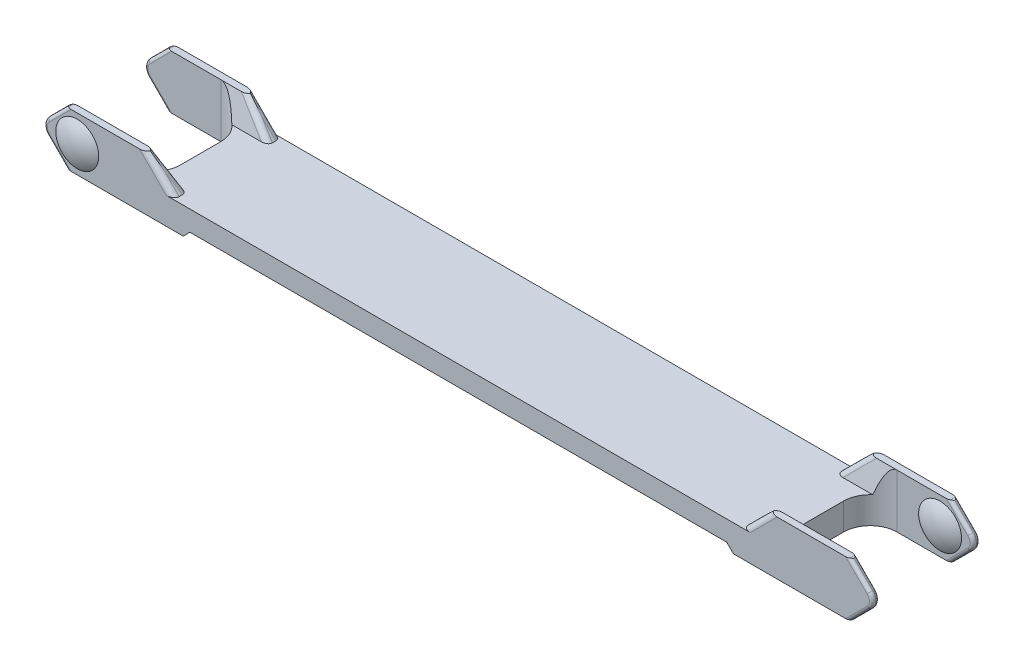
from build123d import *

# Parameters (mm, degrees)
BOSS_EXTRUDE1_DEPTH = 12.7
CUT_EXTRUDE2_DEPTH  = 199.932436772
CUT_EXTRUDE1_DEPTH  = 104.050150898
CUT_EXTRUDE3_DEPTH  = 63.5
CHAMFER1_SIZE       = 1.5875
FILLET1_R           = 0.762
FILLET2_R           = 1.27


# Some blends are built 0.0001 mm under size
with BuildPart() as part:
    # Sketch1 → Boss-Extrude1 (new body)
    with BuildSketch(Plane(origin=(0, 0, 0), x_dir=(1, 0, 0), z_dir=(0, 1, 0))):
        with BuildLine():
            Line((-99.06, -12.7), (99.06, -12.7))
            Line((99.06, -12.7), (99.06, -11.1125))
            Line((99.06, -11.1125), (80.01, -11.1125))
            ThreePointArc((80.01, -11.1125), (75.519871939, -9.252628061), (73.66, -4.7625))
            Line((73.66, -4.7625), (73.66, 4.7625))
            ThreePointArc((73.66, 4.7625), (75.519871939, 9.252628061), (80.01, 11.1125))
            Line((80.01, 11.1125), (99.06, 11.1125))
            Line((99.06, 11.1125), (99.06, 12.7))
            Line((99.06, 12.7), (-99.06, 12.7))
            Line((-99.06, 12.7), (-99.06, 11.1125))
            Line((-99.06, 11.1125), (-80.01, 11.1125))
            ThreePointArc((-80.01, 11.1125), (-75.519871939, 9.252628061), (-73.66, 4.7625))
            Line((-73.66, 4.7625), (-73.66, -4.7625))
            ThreePointArc((-73.66, -4.7625), (-75.519871939, -9.252628061), (-80.01, -11.1125))
            Line((-80.01, -11.1125), (-99.06, -11.1125))
            Line((-99.06, -11.1125), (-99.06, -12.7))
        make_face()
    extrude(amount=BOSS_EXTRUDE1_DEPTH)

    # Sketch3 → Cut-Extrude2 (cut, through all)
    with BuildSketch(Plane.ZY.offset(99.06)):
        Polygon((11.1125, 12.7), (4.7625, 12.7), (-4.7625, 12.7), (-11.1125, 12.7), (-9.525, 6.35), (9.525, 6.35), align=None)
    extrude(amount=-CUT_EXTRUDE2_DEPTH, mode=Mode.SUBTRACT)

    # Sketch2 → Cut-Extrude1 (cut, through all)
    with BuildSketch(Plane.XY.offset(12.7)):
        Polygon((73.66, 12.7), (-73.66, 12.7), (-67.31, 6.35), (67.31, 6.35), align=None)
        with BuildLine():
            Line((97.263948776, 4.553948776), (92.71, 0))
            Line((92.71, 0), (99.06, 0))
            Line((99.06, 0), (99.06, 12.7))
            Line((99.06, 12.7), (92.71, 12.7))
            Line((92.71, 12.7), (97.263948776, 8.146051224))
            ThreePointArc((97.263948776, 8.146051224), (98.007897552, 6.35), (97.263948776, 4.553948776))
        make_face()
        with BuildLine():
            ThreePointArc((-97.263948776, 4.553948776), (-98.007897552, 6.35), (-97.263948776, 8.146051224))
            Line((-97.263948776, 8.146051224), (-92.71, 12.7))
            Line((-92.71, 12.7), (-99.06, 12.7))
            Line((-99.06, 12.7), (-99.06, 0))
            Line((-99.06, 0), (-92.71, 0))
            Line((-92.71, 0), (-97.263948776, 4.553948776))
        make_face()
    extrude(amount=-CUT_EXTRUDE1_DEPTH, mode=Mode.SUBTRACT)

    # Sketch4 → Revolve1 (revolve)
    with BuildSketch(Plane.ZY.offset(90.17)):
        with BuildLine():
            Line((12.7, 6.35), (12.7, 11.43))
            ThreePointArc((12.7, 11.43), (13.881381744, 9.01113492), (14.2875, 6.35))
            Line((14.2875, 6.35), (12.7, 6.35))
        make_face()
    revolve1 = revolve(axis=Axis((-90.17, 6.35, 0), (0, 0, 1)))

    # Mirror1: Revolve1 across plane
    add(revolve1.mirror(Plane.XY))

    # Sketch5 → Revolve2 (revolve)
    with BuildSketch(Plane(origin=(90.17, 0, 0), x_dir=(0, 0, -1), z_dir=(1, 0, 0))):
        with BuildLine():
            Line((11.1125, 6.35), (11.1125, 11.43))
            ThreePointArc((11.1125, 11.43), (9.931118256, 9.01113492), (9.525, 6.35))
            Line((9.525, 6.35), (11.1125, 6.35))
        make_face()
    revolve2 = revolve(axis=Axis((90.17, 6.35, 0), (0, 0, -1)))

    # Mirror2: Revolve2 across plane
    add(revolve2.mirror(Plane.XY))

    # Sketch6 → Cut-Extrude3 (cut, symmetric)
    with BuildSketch(Plane(origin=(0, 0, 0), x_dir=(0, 0, -1), z_dir=(1, 0, 0))):
        Polygon((-12.7, 0), (-11.1125, 0), (-12.7, 1.5875), align=None)
        Polygon((11.1125, 0), (12.7, 1.5875), (12.7, 0), align=None)
    extrude(amount=CUT_EXTRUDE3_DEPTH, both=True, mode=Mode.SUBTRACT)

    # Chamfer1
    chamfer1_edges = [part.edges().sort_by_distance(p)[0] for p in [
        (63.5, 0, 11.90625),
        (63.5, 0, -11.90625),
        (-63.5, 0, -11.90625),
        (-63.5, 0, 11.90625),
    ]]
    chamfer(chamfer1_edges, length=CHAMFER1_SIZE - 0.0001)  # a hair under: the kernel refuses the full size

    # Fillet1
    fillet1_edges = [part.edges().sort_by_distance(p)[0] for p in [
        (-98.007897552, 6.35, 12.7),
        (-92.71, 12.7, -11.90625),
        (-94.986974388, 10.423025612, -11.1125),
        (-94.986974388, 10.423025612, -12.7),
        (-94.986974388, 10.423025612, 11.1125),
        (-92.71, 12.7, 11.90625),
        (-94.986974388, 2.276974388, 12.7),
        (-98.007897552, 6.35, -11.1125),
        (-98.007897552, 6.35, 11.1125),
        (-94.986974388, 2.276974388, -11.1125),
        (-94.986974388, 2.276974388, 11.1125),
        (-98.007897552, 6.35, -12.7),
        (-94.986974388, 2.276974388, -12.7),
        (-94.986974388, 10.423025612, 12.7),
        (98.007897552, 6.35, 12.7),
        (92.71, 12.7, 11.90625),
        (92.71, 12.7, -11.90625),
        (94.986974388, 10.423025612, 12.7),
        (94.986974388, 2.276974388, 11.1125),
        (94.986974388, 2.276974388, -11.1125),
        (94.986974388, 2.276974388, -12.7),
        (98.007897552, 6.35, 11.1125),
        (94.986974388, 10.423025612, 11.1125),
        (94.986974388, 10.423025612, -11.1125),
        (98.007897552, 6.35, -12.7),
        (94.986974388, 10.423025612, -12.7),
        (94.986974388, 2.276974388, 12.7),
        (98.007897552, 6.35, -11.1125),
    ]]
    fillet(fillet1_edges, radius=FILLET1_R)

    # Fillet2
    # the kernel refuses this fillet: 1.27 mm, written as the material it takes off along each edge
    with BuildSketch(Plane(origin=(-75.90506403, 14.94506403, -12.7), x_dir=(-0.7071067811865446, -0.7071067811865505, 0), z_dir=(0.7071067811865506, -0.7071067811865446, 0))) as fillet2_piece_1_section:
        with BuildLine():
            CenterArc((FILLET2_R, -FILLET2_R), FILLET2_R, 90, 90)
            Line((0, -FILLET2_R), (0, 0))
            Line((0, 0), (FILLET2_R, 0))
        make_face()
    fillet2_piece_1 = extrude(amount=15.330256121, mode=Mode.PRIVATE)
    fillet2_piece_1 = split(fillet2_piece_1, bisect_by=Plane(origin=(-71.905795305, 6.35, -12.408746665), z_dir=(0, 1, 0)), keep=Keep.TOP, mode=Mode.PRIVATE)
    add(fillet2_piece_1, mode=Mode.SUBTRACT)
    with BuildSketch(Plane(origin=(-65.450815483, 4.490815483, -9.060203871), x_dir=(0.1230914909792504, -0.12309149097924957, -0.9847319278346824), z_dir=(-0.696310623822809, 0.6963106238228031, -0.17407765595558086))) as fillet2_piece_2_section:
        with BuildLine():
            CenterArc((FILLET2_R * 0.840960781889, FILLET2_R), FILLET2_R, 189.874961398, 80.125038602)
            Line((-FILLET2_R * 0.144223584254, FILLET2_R * 0.828501414858), (0, 0))
            Line((0, 0), (FILLET2_R * 0.840960781889, 0))
        make_face()
    fillet2_piece_2 = extrude(amount=14.459594166, mode=Mode.PRIVATE)
    fillet2_piece_2 = split(fillet2_piece_2, bisect_by=Plane(origin=(-71.646234354, 6.35, -10.770930609), z_dir=(0, 1, 0)), keep=Keep.TOP, mode=Mode.PRIVATE)
    add(fillet2_piece_2, mode=Mode.SUBTRACT)
    with BuildSketch(Plane(origin=(-75.519184517, 14.559184517, 11.577296129), x_dir=(-0.7177405625652845, -0.6755205294731655, -0.1688801323683837), z_dir=(0.69631062382278, -0.6963106238227741, -0.17407765595581334))) as fillet2_piece_3_section:
        with BuildLine():
            CenterArc((FILLET2_R * 0.840960781889, -FILLET2_R), FILLET2_R, 90, 80.125038602)
            Line((-FILLET2_R * 0.144223584254, -FILLET2_R * 0.828501414857), (0, 0))
            Line((0, 0), (FILLET2_R * 0.840960781889, 0))
        make_face()
    fillet2_piece_3 = extrude(amount=14.459594166, mode=Mode.PRIVATE)
    fillet2_piece_3 = split(fillet2_piece_3, bisect_by=Plane(origin=(-71.646234354, 6.35, 10.770930609), z_dir=(0, 1, 0)), keep=Keep.TOP, mode=Mode.PRIVATE)
    add(fillet2_piece_3, mode=Mode.SUBTRACT)
    with BuildSketch(Plane(origin=(-75.90506403, 14.94506403, 12.7), x_dir=(-0.7071067811865445, -0.7071067811865505, 0), z_dir=(0.7071067811865506, -0.7071067811865446, 0))) as fillet2_piece_4_section:
        with BuildLine():
            CenterArc((FILLET2_R, FILLET2_R), FILLET2_R, 180, 90)
            Line((0, FILLET2_R), (0, 0))
            Line((0, 0), (FILLET2_R, 0))
        make_face()
    fillet2_piece_4 = extrude(amount=15.330256121, mode=Mode.PRIVATE)
    fillet2_piece_4 = split(fillet2_piece_4, bisect_by=Plane(origin=(-71.905795305, 6.35, 12.408746665), z_dir=(0, 1, 0)), keep=Keep.TOP, mode=Mode.PRIVATE)
    add(fillet2_piece_4, mode=Mode.SUBTRACT)
    with BuildSketch(Plane(origin=(65.06493597, 4.10493597, -12.7), x_dir=(0.7071067811865445, -0.7071067811865506, 0), z_dir=(0.7071067811865506, 0.7071067811865445, 0))) as fillet2_piece_5_section:
        with BuildLine():
            CenterArc((FILLET2_R, -FILLET2_R), FILLET2_R, 90, 90)
            Line((0, -FILLET2_R), (0, 0))
            Line((0, 0), (FILLET2_R, 0))
        make_face()
    fillet2_piece_5 = extrude(amount=15.330256121, mode=Mode.PRIVATE)
    fillet2_piece_5 = split(fillet2_piece_5, bisect_by=Plane(origin=(71.905795305, 6.35, -12.408746665), z_dir=(0, 1, 0)), keep=Keep.TOP, mode=Mode.PRIVATE)
    add(fillet2_piece_5, mode=Mode.SUBTRACT)
    with BuildSketch(Plane(origin=(75.519184517, 14.559184517, -11.577296129), x_dir=(-0.12309149097927001, -0.12309149097926336, -0.9847319278346782), z_dir=(-0.6963106238228061, -0.6963106238228001, 0.17407765595560445))) as fillet2_piece_6_section:
        with BuildLine():
            CenterArc((FILLET2_R * 0.840960781889, FILLET2_R), FILLET2_R, 189.874961398, 80.125038602)
            Line((-FILLET2_R * 0.144223584254, FILLET2_R * 0.828501414858), (0, 0))
            Line((0, 0), (FILLET2_R * 0.84096078189, 0))
        make_face()
    fillet2_piece_6 = extrude(amount=14.459594166, mode=Mode.PRIVATE)
    fillet2_piece_6 = split(fillet2_piece_6, bisect_by=Plane(origin=(71.646234354, 6.35, -10.770930609), z_dir=(0, 1, 0)), keep=Keep.TOP, mode=Mode.PRIVATE)
    add(fillet2_piece_6, mode=Mode.SUBTRACT)
    with BuildSketch(Plane(origin=(65.06493597, 4.10493597, 12.7), x_dir=(0.7071067811865445, -0.7071067811865507, 0), z_dir=(0.7071067811865506, 0.7071067811865445, 0))) as fillet2_piece_7_section:
        with BuildLine():
            CenterArc((FILLET2_R, FILLET2_R), FILLET2_R, 180, 90)
            Line((0, FILLET2_R), (0, 0))
            Line((0, 0), (FILLET2_R, 0))
        make_face()
    fillet2_piece_7 = extrude(amount=15.330256121, mode=Mode.PRIVATE)
    fillet2_piece_7 = split(fillet2_piece_7, bisect_by=Plane(origin=(71.905795305, 6.35, 12.408746665), z_dir=(0, 1, 0)), keep=Keep.TOP, mode=Mode.PRIVATE)
    add(fillet2_piece_7, mode=Mode.SUBTRACT)
    with BuildSketch(Plane(origin=(65.450815483, 4.490815483, 9.060203871), x_dir=(0.7177405625652817, -0.6755205294731627, -0.16888013236840813), z_dir=(0.6963106238227829, 0.6963106238227769, 0.1740776559557897))) as fillet2_piece_8_section:
        with BuildLine():
            CenterArc((FILLET2_R * 0.840960781889, -FILLET2_R), FILLET2_R, 90, 80.125038602)
            Line((-FILLET2_R * 0.144223584254, -FILLET2_R * 0.828501414857), (0, 0))
            Line((0, 0), (FILLET2_R * 0.840960781889, 0))
        make_face()
    fillet2_piece_8 = extrude(amount=14.459594166, mode=Mode.PRIVATE)
    fillet2_piece_8 = split(fillet2_piece_8, bisect_by=Plane(origin=(71.646234354, 6.35, 10.770930609), z_dir=(0, 1, 0)), keep=Keep.TOP, mode=Mode.PRIVATE)
    add(fillet2_piece_8, mode=Mode.SUBTRACT)


solid = part.part
